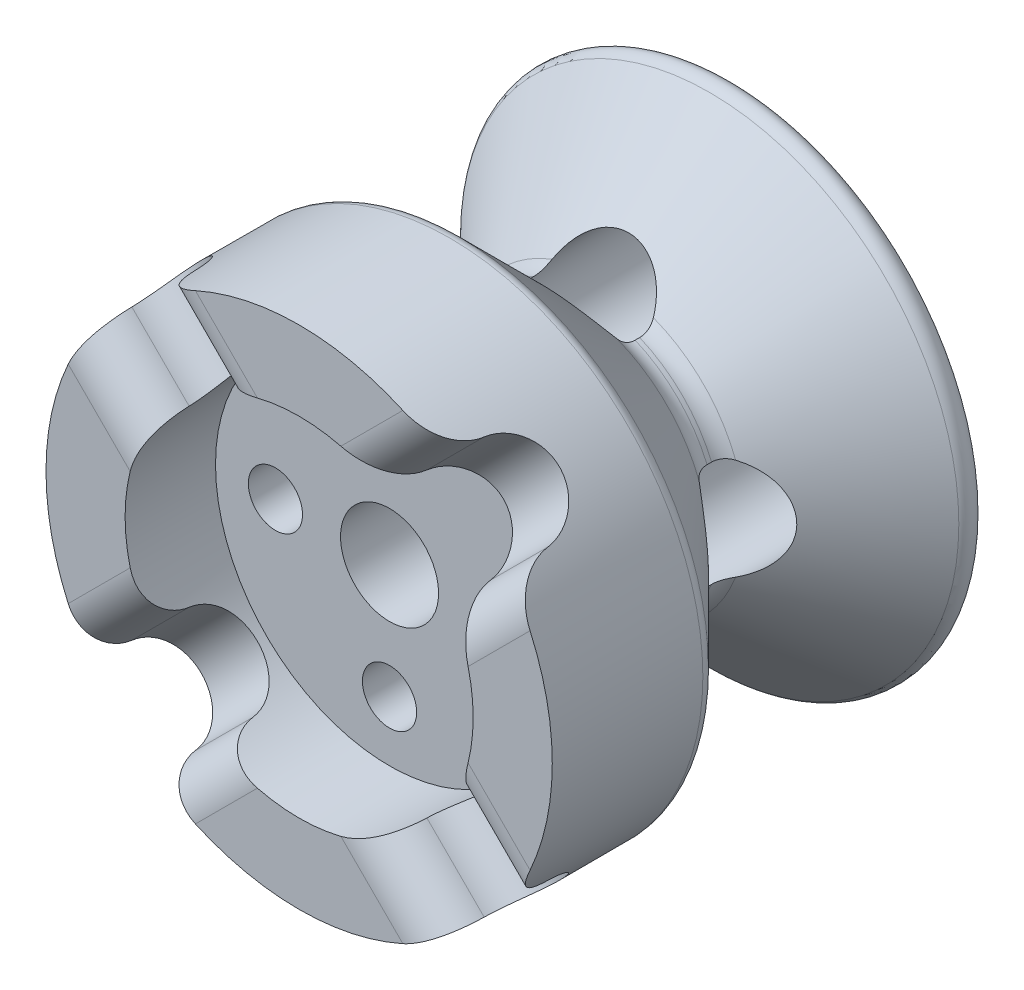
from build123d import *

# Parameters (mm, degrees)
SKETCH1_R           = 14.224
SKETCH1_R_2         = 9.779
BOSS_EXTRUDE1_DEPTH = 5.08
SKETCH3_R           = 3.0353
CUT_EXTRUDE1_DEPTH  = 24.522100707
SKETCH3_3_R         = 1.524
CUT_EXTRUDE2_DEPTH  = 24.522100707
CIRPATTERN1_COUNT   = 4
SKETCH5_R           = 2.54
CUT_EXTRUDE3_DEPTH  = 32.598687045
FILLET3_R           = 2.54
CIRPATTERN3_START   = 1.982941551
CIRPATTERN3_DEPTH   = 13.017058449
CIRPATTERN3_START_2 = -15
CIRPATTERN3_2_DEPTH = 30


with BuildPart() as part:
    # Sketch1 → Boss-Extrude1 (new body)
    with BuildSketch(Plane.XY):
        Circle(SKETCH1_R)
        Circle(SKETCH1_R_2, mode=Mode.SUBTRACT)
    extrude(amount=-BOSS_EXTRUDE1_DEPTH)

    # Sketch2 → Revolve1 (revolve)
    with BuildSketch(Plane(origin=(0, 0, 0), x_dir=(1, 0, 0), z_dir=(0, 1, 0)), mode=Mode.PRIVATE) as revolve1_sk:
        with BuildLine():
            Line((-2.754, 5.08), (-2.754, 21.234))
            ThreePointArc((-2.754, 21.234), (-3.672127089, 23.45055487), (-5.888681959, 24.368681959))
            Line((-5.888681959, 24.368681959), (-13.462, 24.368681959))
            ThreePointArc((-13.462, 24.368681959), (-14.165996204, 23.898286734), (-14.000815367, 23.067866591))
            Line((-14.000815367, 23.067866591), (-7.991974388, 17.059025612))
            ThreePointArc((-7.991974388, 17.059025612), (-7.716672994, 16.647007959), (-7.62, 16.161))
            Line((-7.62, 16.161), (-7.62, 15.907))
            ThreePointArc((-7.62, 15.907), (-7.716672994, 15.420992041), (-7.991974388, 15.008974388))
            Line((-7.991974388, 15.008974388), (-14.000815367, 9.000133409))
            ThreePointArc((-14.000815367, 9.000133409), (-14.165996204, 8.752922817), (-14.224, 8.461318041))
            Line((-14.224, 8.461318041), (-14.224, 5.08))
            Line((-14.224, 5.08), (-2.754, 5.08))
        make_face()
    revolve(revolve1_sk.sketch.rotate(Axis((0, 0, 0), (0, 0, -1)), 180), axis=Axis((0, 0, 0), (0, 0, -1)))

    # Sketch3 → Cut-Extrude1 (cut, through all)
    with BuildSketch(Plane.XY.offset(-12.192)):
        with Locations((0, -6.413072646)):
            Circle(SKETCH3_R)
    cut_extrude1 = extrude(amount=-CUT_EXTRUDE1_DEPTH, mode=Mode.SUBTRACT)

    # Sketch3<3> → Cut-Extrude2 (cut, through all)
    with BuildSketch(Plane.XY.offset(-12.192)):
        with Locations(Location((0, -6.413072646, 0), (0, 0, 180))):
            Circle(SKETCH3_3_R)
    cut_extrude2 = extrude(amount=CUT_EXTRUDE2_DEPTH, mode=Mode.SUBTRACT)

    # CirPattern1: Cut-Extrude1, Cut-Extrude2 ×4 about axis
    cirpattern1_axis = Axis((0, 0, 0), (0, 0, 1))
    add([cut_extrude1.rotate(cirpattern1_axis, i * 360 / CIRPATTERN1_COUNT) for i in range(1, CIRPATTERN1_COUNT)], mode=Mode.SUBTRACT)
    add([cut_extrude2.rotate(cirpattern1_axis, i * 360 / CIRPATTERN1_COUNT) for i in range(1, CIRPATTERN1_COUNT)], mode=Mode.SUBTRACT)

    # Sketch5 → Cut-Extrude3 (cut, through all)
    with BuildSketch(Plane(origin=(0, 0, 0), x_dir=(0.7071067811865487, 0.7071067811865465, 0), z_dir=(-0.7071067811865465, 0.7071067811865487, 0))):
        with Locations((0, 2.032)):
            Circle(SKETCH5_R)
    extrude(amount=CUT_EXTRUDE3_DEPTH, mode=Mode.SUBTRACT)

    # Fillet3
    # the kernel refuses this fillet: 2.54 mm, written as the material it takes off along each edge
    with BuildSketch(Plane(origin=(-17.318785921, 15.163524452, 0), x_dir=(-0.28416876048229095, -0.28416876048229006, -0.9156943983294411), z_dir=(0.7071067811865465, -0.7071067811865487, 0))) as fillet3_piece_1:
        with BuildLine():
            CenterArc((3.744699112, -2.212128903), FILLET3_R, 119.434636416, 84.260829523)
            Line((1.41883534, -3.232892204), (0, 0))
            ThreePointArc((0, 0), (1.248233037, -0.327871097), (2.496466074, 0))
        make_face()
    extrude(amount=22.135285574, mode=Mode.SUBTRACT)
    with BuildSketch(Plane(origin=(-15.163524452, 17.318785921, 0), x_dir=(0.28416876048229134, 0.28416876048229045, -0.915694398329441), z_dir=(0.7071067811865465, -0.7071067811865487, 0))) as fillet3_piece_2:
        with BuildLine():
            CenterArc((3.744699112, 2.212128903), FILLET3_R, 156.304534061, 84.260829523)
            Line((1.41883534, 3.232892204), (0, 0))
            ThreePointArc((0, 0), (1.248233037, 0.327871097), (2.496466074, 0))
        make_face()
    extrude(amount=22.135285574, mode=Mode.SUBTRACT)

    # CirPattern3: read off the stored shape, not the designer's step
    # CirPattern3 outline → CirPattern3 (cut)
    with BuildSketch(Plane(origin=(0, 0, 0), x_dir=(0.707106781186549, 0.707106781186546, 0), z_dir=(0.707106781186546, -0.707106781186549, 0)).offset(CIRPATTERN3_START)):
        with BuildLine():
            ThreePointArc((-2.527268095, -2.285999951), (5.8e-08, -4.572), (2.527268107, -2.285999836))
            ThreePointArc((2.527268107, -2.285999836), (3.350652382, -0.656285584), (5.054536181, 0))
            Line((5.054536181, 0), (-5.054536181, 0))
            ThreePointArc((-5.054536181, 0), (-3.350652382, -0.656285584), (-2.527268095, -2.285999951))
        make_face()
    extrude(amount=CIRPATTERN3_DEPTH, mode=Mode.SUBTRACT)

    # CirPattern3 2 outline → CirPattern3 2 (cut)
    with BuildSketch(Plane(origin=(0, 0, 0), x_dir=(0.707106781186549, -0.707106781186546, 0), z_dir=(0.707106781186546, 0.707106781186549, 0)).offset(CIRPATTERN3_START_2)):
        with BuildLine():
            ThreePointArc((5.054536181, 0), (3.350652382, 0.656285584), (2.52726809, 2.286))
            ThreePointArc((2.52726809, 2.286), (-5.4e-08, 4.572), (-2.527268109, 2.285999815))
            ThreePointArc((-2.527268109, 2.285999815), (-3.350652382, 0.656285584), (-5.054536181, 0))
            Line((-5.054536181, 0), (5.054536181, 0))
        make_face()
    extrude(amount=CIRPATTERN3_2_DEPTH, mode=Mode.SUBTRACT)


solid = part.part
